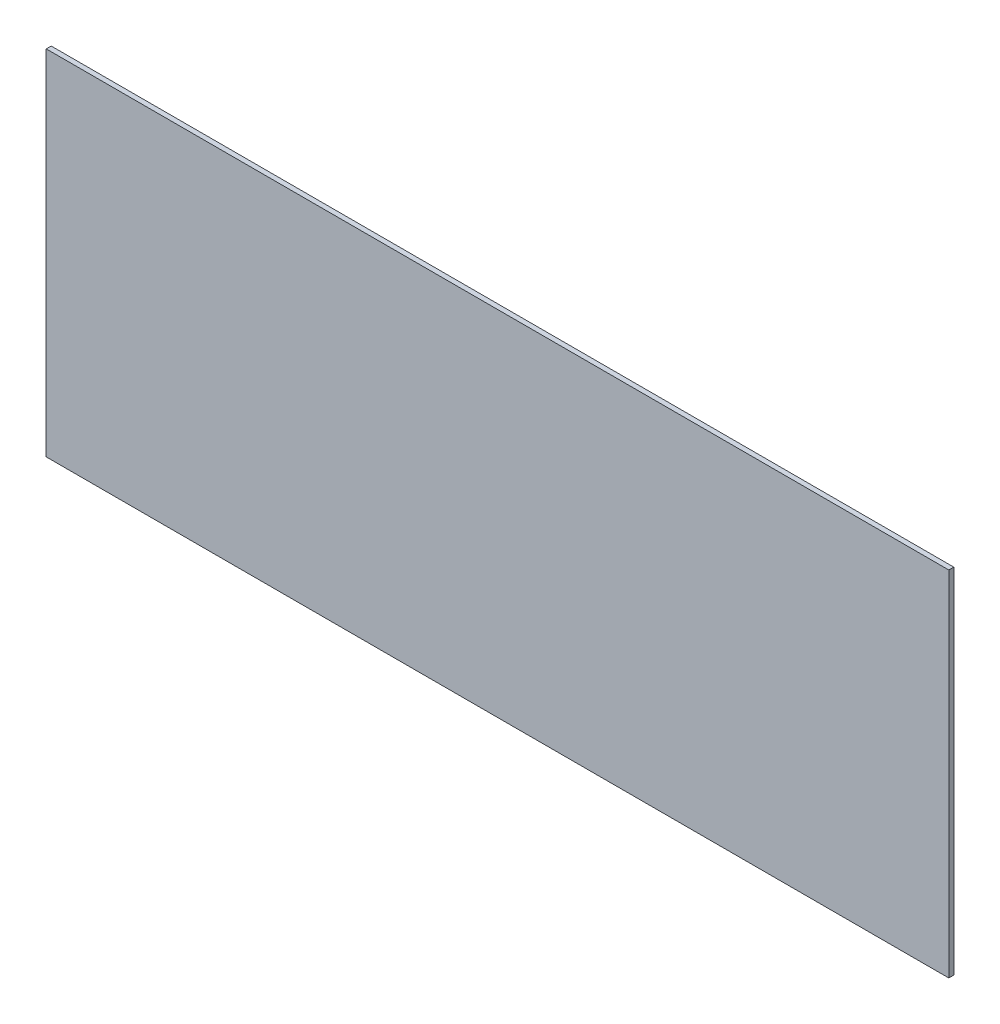
from build123d import *

# Parameters (mm, degrees)
SKETCH1_W           = 23.008
SKETCH1_H           = 9.008
BOSS_EXTRUDE1_DEPTH = 0.127
WRAP1_START         = -0.0762
WRAP1_DEPTH         = 0.0762


# Read off the part's stored shape, not the designer's step: Wrap1
with BuildPart() as part:
    # Sketch1 → Boss-Extrude1 (new body)
    with BuildSketch(Plane.XY):
        with Locations((3082.138757164, 1134.305694712)):
            Rectangle(SKETCH1_W, SKETCH1_H)
    extrude(amount=BOSS_EXTRUDE1_DEPTH)

    # Wrap1 outline → Wrap1 (cut)
    # profile 1 of 6: a face of its own
    with BuildSketch(Plane(origin=(0, 0, 0), x_dir=(-1, 0, 0), z_dir=(0, 0, -1)).offset(WRAP1_START)):
        with BuildLine():
            Line((-3091.032253185, 1132.70167119), (-3091.664348003, 1132.70167119))
            add(Edge.make_bspline(
                [(-3091.664348003, 1132.70167119), (-3091.689861104, 1132.700745243), (-3091.737904003, 1132.699001621), (-3091.804787005, 1132.687352026), (-3091.861891162, 1132.6680349), (-3091.909469605, 1132.640629319), (-3091.945465422, 1132.602956777), (-3091.972332248, 1132.558738878), (-3091.986957789, 1132.505789095), (-3091.98904074, 1132.468363072), (-3091.990142194, 1132.448572387)],
                knots=[0, 0, 0, 0, 0.162897657, 0.306747336, 0.431731416, 0.546374995, 0.653433857, 0.760997037, 0.873616484, 1, 1, 1, 1], degree=3))
            add(Edge.make_bspline(
                [(-3091.990142194, 1132.448572387), (-3091.989087181, 1132.427226643), (-3091.987100987, 1132.387040591), (-3091.972081369, 1132.330609371), (-3091.947181795, 1132.28256978), (-3091.911682944, 1132.243439535), (-3091.866731732, 1132.213103672), (-3091.812074197, 1132.192347186), (-3091.74811324, 1132.17935964), (-3091.702322565, 1132.17782091), (-3091.677927647, 1132.177001154)],
                knots=[0, 0, 0, 0, 0.13549594, 0.255088173, 0.36798027, 0.476021954, 0.587257675, 0.709320559, 0.84514094, 1, 1, 1, 1], degree=3))
            Line((-3091.677927647, 1132.177001154), (-3089.894643621, 1132.177002056))
            add(Edge.make_bspline(
                [(-3089.894643621, 1132.177002056), (-3089.867357056, 1132.177106437), (-3089.816294229, 1132.177301771), (-3089.745007602, 1132.189731835), (-3089.684415238, 1132.208630912), (-3089.633225812, 1132.234862515), (-3089.595441587, 1132.272660527), (-3089.567204421, 1132.317149031), (-3089.552769492, 1132.371054555), (-3089.551362677, 1132.409087208), (-3089.550619656, 1132.429174442)],
                knots=[0, 0, 0, 0, 0.167323449, 0.313121427, 0.442287347, 0.556528349, 0.662166905, 0.766596956, 0.876726412, 1, 1, 1, 1], degree=3))
            add(Edge.make_bspline(
                [(-3089.550619656, 1132.429174442), (-3089.551668879, 1132.450525887), (-3089.553644172, 1132.490722673), (-3089.568736874, 1132.547081924), (-3089.593480126, 1132.595556786), (-3089.630397051, 1132.634211595), (-3089.675586247, 1132.665750864), (-3089.731816795, 1132.686383635), (-3089.79727598, 1132.699293202), (-3089.844288634, 1132.700844218), (-3089.869300184, 1132.701669386)],
                knots=[0, 0, 0, 0, 0.13367795, 0.251665576, 0.363042966, 0.47093762, 0.583363643, 0.705585, 0.843366093, 1, 1, 1, 1], degree=3))
            Line((-3089.869300184, 1132.701669386), (-3090.507584051, 1132.70167119))
            Line((-3090.507584051, 1132.70167119), (-3090.507584051, 1136.070447674))
            add(Edge.make_bspline(
                [(-3090.507584051, 1136.070447674), (-3090.507392066, 1136.090466065), (-3090.507040471, 1136.127127021), (-3090.509196868, 1136.176991703), (-3090.511323971, 1136.217190786), (-3090.517297737, 1136.256675714), (-3090.528509266, 1136.298761128), (-3090.548529631, 1136.324649335), (-3090.558389095, 1136.337398545)],
                knots=[0, 0, 0, 0, 0.216060692, 0.395685733, 0.538969935, 0.649917571, 0.82759431, 1, 1, 1, 1], degree=3))
            add(Edge.make_bspline(
                [(-3090.558389095, 1136.337398545), (-3090.572343179, 1136.350688209), (-3090.600117984, 1136.377140525), (-3090.651684532, 1136.405323969), (-3090.710385719, 1136.422159653), (-3090.751943423, 1136.424732987), (-3090.773613916, 1136.426074866)],
                knots=[0, 0, 0, 0, 0.240761183, 0.479221355, 0.728437127, 1, 1, 1, 1], degree=3))
            add(Edge.make_bspline(
                [(-3090.773613916, 1136.426074866), (-3090.794626492, 1136.426383757), (-3090.834068317, 1136.426963564), (-3090.889504837, 1136.413775263), (-3090.936592789, 1136.389620197), (-3090.973729365, 1136.352344936), (-3091.002973495, 1136.305118), (-3091.021417598, 1136.246484684), (-3091.032825396, 1136.177740875), (-3091.032453259, 1136.128386645), (-3091.032253185, 1136.101852067)],
                knots=[0, 0, 0, 0, 0.1303468, 0.244668505, 0.350952396, 0.455284039, 0.568004952, 0.693428508, 0.835176339, 1, 1, 1, 1], degree=3))
            Line((-3091.032253185, 1136.101852067), (-3091.032253185, 1132.70167119))
        make_face()
    # profile 2 of 6: a face of its own
    with BuildSketch(Plane(origin=(0, 0, 0), x_dir=(-1, 0, 0), z_dir=(0, 0, -1)).offset(WRAP1_START)):
        with BuildLine():
            Line((-3088.189593645, 1135.7166652), (-3088.349213549, 1136.233317708))
            add(Edge.make_bspline(
                [(-3088.349213549, 1136.233317708), (-3088.354084507, 1136.249154792), (-3088.36338243, 1136.279385395), (-3088.385650895, 1136.319441486), (-3088.409892106, 1136.354512012), (-3088.440698145, 1136.381774889), (-3088.475177195, 1136.403447756), (-3088.514375293, 1136.418367583), (-3088.558285406, 1136.425507392), (-3088.58870514, 1136.425878998), (-3088.604738899, 1136.426074866)],
                knots=[0, 0, 0, 0, 0.141702392, 0.270488466, 0.391455134, 0.505507001, 0.62056348, 0.739260185, 0.862568177, 1, 1, 1, 1], degree=3))
            add(Edge.make_bspline(
                [(-3088.604738899, 1136.426074866), (-3088.623619207, 1136.425247441), (-3088.659708091, 1136.423665855), (-3088.711192269, 1136.409863077), (-3088.75776185, 1136.389183685), (-3088.797315359, 1136.35911058), (-3088.830797413, 1136.323697326), (-3088.854764252, 1136.281574597), (-3088.870424779, 1136.23376878), (-3088.872471003, 1136.199894913), (-3088.873538997, 1136.182214983)],
                knots=[0, 0, 0, 0, 0.139395097, 0.266447653, 0.391794452, 0.513870771, 0.631533225, 0.749898934, 0.8694637, 1, 1, 1, 1], degree=3))
            add(Edge.make_bspline(
                [(-3088.873538997, 1136.182214983), (-3088.87310161, 1136.170812912), (-3088.872235199, 1136.148226771), (-3088.867474502, 1136.112164656), (-3088.855256874, 1136.069450506), (-3088.846410223, 1136.037501511), (-3088.841209088, 1136.018718016)],
                knots=[0, 0, 0, 0, 0.204595306, 0.40527887, 0.650350765, 1, 1, 1, 1], degree=3))
            Line((-3088.841209088, 1136.018718016), (-3087.742657915, 1132.417925726))
            add(Edge.make_bspline(
                [(-3087.742657915, 1132.417925726), (-3087.736296283, 1132.396484229), (-3087.724398496, 1132.356383458), (-3087.698475546, 1132.304029111), (-3087.673757527, 1132.259868469), (-3087.642890662, 1132.227287653), (-3087.608040108, 1132.202964263), (-3087.567192916, 1132.186112961), (-3087.519771901, 1132.177153086), (-3087.486160141, 1132.177053343), (-3087.468573537, 1132.177001154)],
                knots=[0, 0, 0, 0, 0.166404298, 0.311216181, 0.434859544, 0.542060845, 0.642692704, 0.749721755, 0.869047485, 1, 1, 1, 1], degree=3))
            add(Edge.make_bspline(
                [(-3087.468573537, 1132.177001154), (-3087.452519127, 1132.176747551), (-3087.422052227, 1132.176266281), (-3087.378598764, 1132.184356886), (-3087.338910114, 1132.196529938), (-3087.304544285, 1132.217609662), (-3087.274404286, 1132.243751055), (-3087.248884638, 1132.276360255), (-3087.227554815, 1132.314922168), (-3087.218365144, 1132.343991205), (-3087.213629115, 1132.358972354)],
                knots=[0, 0, 0, 0, 0.140277472, 0.266208441, 0.38561614, 0.501718756, 0.616402935, 0.733503765, 0.862657308, 1, 1, 1, 1], degree=3))
            Line((-3087.213629115, 1132.358972354), (-3086.127304492, 1135.974980629))
            add(Edge.make_bspline(
                [(-3086.127304492, 1135.974980629), (-3086.122369271, 1135.991399736), (-3086.1131975, 1136.021913522), (-3086.101046473, 1136.063473676), (-3086.093117816, 1136.09730565), (-3086.084389473, 1136.129294007), (-3086.077655767, 1136.160975457), (-3086.076882779, 1136.184649868), (-3086.076540041, 1136.195146947)],
                knots=[0, 0, 0, 0, 0.22700634, 0.421875753, 0.573150886, 0.686858716, 0.861155217, 1, 1, 1, 1], degree=3))
            add(Edge.make_bspline(
                [(-3086.076540041, 1136.195146947), (-3086.077565322, 1136.211320478), (-3086.079569561, 1136.2429368), (-3086.096516142, 1136.287052903), (-3086.120727288, 1136.32737218), (-3086.155240442, 1136.360609937), (-3086.195447417, 1136.388669599), (-3086.240477688, 1136.410313553), (-3086.291208637, 1136.422098627), (-3086.326195749, 1136.424713227), (-3086.344416427, 1136.426074866)],
                knots=[0, 0, 0, 0, 0.123314737, 0.241057959, 0.357426238, 0.480695961, 0.604213056, 0.731731648, 0.860290518, 1, 1, 1, 1], degree=3))
            add(Edge.make_bspline(
                [(-3086.344416427, 1136.426074866), (-3086.373999664, 1136.424829101), (-3086.429120714, 1136.422507927), (-3086.504191022, 1136.391388161), (-3086.562882952, 1136.337799184), (-3086.583224767, 1136.28955198), (-3086.59381858, 1136.264425322)],
                knots=[0, 0, 0, 0, 0.275840125, 0.513959899, 0.746875208, 1, 1, 1, 1], degree=3))
            Line((-3086.59381858, 1136.264425322), (-3086.75939931, 1135.7166652))
            Line((-3086.75939931, 1135.7166652), (-3088.189593645, 1135.7166652))
        make_face()
        Polygon((-3088.023588945, 1135.191996066), (-3086.92540401, 1135.191996066), (-3087.474496478, 1133.353443593), align=None, mode=Mode.SUBTRACT)
    # profile 3 of 6: a face of its own
    with BuildSketch(Plane(origin=(0, 0, 0), x_dir=(-1, 0, 0), z_dir=(0, 0, -1)).offset(WRAP1_START)):
        with BuildLine():
            Line((-3083.523767204, 1132.70167119), (-3085.06888787, 1132.70167119))
            add(Edge.make_bspline(
                [(-3085.06888787, 1132.70167119), (-3085.095973862, 1132.701799579), (-3085.146465823, 1132.702038914), (-3085.216799298, 1132.691492276), (-3085.275633763, 1132.670918659), (-3085.324529272, 1132.642404485), (-3085.361718573, 1132.603209752), (-3085.38740724, 1132.555113162), (-3085.401260635, 1132.497987097), (-3085.401290789, 1132.457268205), (-3085.401306805, 1132.435640423)],
                knots=[0, 0, 0, 0, 0.164401574, 0.30646683, 0.429516722, 0.541147658, 0.646987278, 0.753272194, 0.868950875, 1, 1, 1, 1], degree=3))
            add(Edge.make_bspline(
                [(-3085.401306805, 1132.435640423), (-3085.401245958, 1132.414619081), (-3085.401131773, 1132.375170753), (-3085.387926638, 1132.320001356), (-3085.364977804, 1132.272717247), (-3085.328677806, 1132.235830666), (-3085.28349275, 1132.206464), (-3085.22704349, 1132.187646902), (-3085.160975649, 1132.176545484), (-3085.11346748, 1132.176842818), (-3085.088168547, 1132.177001154)],
                knots=[0, 0, 0, 0, 0.133385332, 0.250308863, 0.358107032, 0.463454922, 0.575429264, 0.698153607, 0.839261499, 1, 1, 1, 1], degree=3))
            Line((-3085.088168547, 1132.177001154), (-3083.33222332, 1132.177002056))
            add(Edge.make_bspline(
                [(-3083.33222332, 1132.177002056), (-3083.302596628, 1132.177028806), (-3083.247926702, 1132.177078167), (-3083.172996724, 1132.189837525), (-3083.111843229, 1132.211110005), (-3083.063546087, 1132.244804285), (-3083.0312525, 1132.294176878), (-3083.009245166, 1132.355690307), (-3082.999148242, 1132.432251413), (-3083.000075164, 1132.4876624), (-3083.000580158, 1132.517850763)],
                knots=[0, 0, 0, 0, 0.156514694, 0.288815458, 0.400161158, 0.496932744, 0.594087477, 0.706959909, 0.840349341, 1, 1, 1, 1], degree=3))
            Line((-3083.000580158, 1132.517850763), (-3083.000213921, 1136.078384017))
            add(Edge.make_bspline(
                [(-3083.000213921, 1136.078384017), (-3082.999408286, 1136.108978566), (-3082.997926048, 1136.165267531), (-3083.004593344, 1136.243443319), (-3083.024438832, 1136.306335929), (-3083.055364444, 1136.356560068), (-3083.102638143, 1136.39121991), (-3083.16415529, 1136.413719499), (-3083.240576665, 1136.425845863), (-3083.296432587, 1136.42599447), (-3083.32665038, 1136.426074866)],
                knots=[0, 0, 0, 0, 0.16005613, 0.294477095, 0.40801996, 0.502248162, 0.597570488, 0.70819914, 0.842137095, 1, 1, 1, 1], degree=3))
            Line((-3083.32665038, 1136.426074866), (-3085.06888787, 1136.426074866))
            add(Edge.make_bspline(
                [(-3085.06888787, 1136.426074866), (-3085.097519646, 1136.42585017), (-3085.150772812, 1136.425432251), (-3085.224846618, 1136.414685237), (-3085.287147642, 1136.395497266), (-3085.338934719, 1136.368105205), (-3085.378130218, 1136.329648143), (-3085.405799619, 1136.282969842), (-3085.420912109, 1136.227155191), (-3085.420776652, 1136.187539816), (-3085.420704751, 1136.166511885)],
                knots=[0, 0, 0, 0, 0.17008837, 0.316352865, 0.443130698, 0.55620467, 0.661053016, 0.765276352, 0.875408155, 1, 1, 1, 1], degree=3))
            add(Edge.make_bspline(
                [(-3085.420704751, 1136.166511885), (-3085.420684468, 1136.144887354), (-3085.420646282, 1136.104174584), (-3085.406846303, 1136.04700781), (-3085.381076981, 1135.999237009), (-3085.344954125, 1135.959833313), (-3085.296864075, 1135.93078854), (-3085.238379089, 1135.912211377), (-3085.169894144, 1135.900887054), (-3085.120856396, 1135.901225602), (-3085.094634529, 1135.901406633)],
                knots=[0, 0, 0, 0, 0.132714985, 0.249864141, 0.35750012, 0.463388537, 0.574824211, 0.698817694, 0.838949322, 1, 1, 1, 1], degree=3))
            Line((-3085.094634529, 1135.901406633), (-3083.523767204, 1135.901406633))
            Line((-3083.523767204, 1135.901406633), (-3083.523767204, 1134.297844065))
            Line((-3083.523767204, 1134.297844065), (-3084.62195214, 1134.297844065))
            add(Edge.make_bspline(
                [(-3084.62195214, 1134.297844065), (-3084.64899768, 1134.297604901), (-3084.699447206, 1134.297158776), (-3084.769541204, 1134.286527166), (-3084.828470572, 1134.267128748), (-3084.877354004, 1134.23953675), (-3084.914615377, 1134.201300076), (-3084.940136659, 1134.154356961), (-3084.954234953, 1134.098822059), (-3084.954231951, 1134.059300589), (-3084.954230354, 1134.038280182)],
                knots=[0, 0, 0, 0, 0.166190244, 0.310003759, 0.433947569, 0.545980445, 0.651758679, 0.75768932, 0.871121468, 1, 1, 1, 1], degree=3))
            add(Edge.make_bspline(
                [(-3084.954230354, 1134.038280182), (-3084.9538903, 1134.016929199), (-3084.953250728, 1133.976772366), (-3084.938805954, 1133.920949396), (-3084.916110001, 1133.872701495), (-3084.880086636, 1133.834715347), (-3084.834357175, 1133.805593704), (-3084.778823349, 1133.785822731), (-3084.713684692, 1133.773490075), (-3084.667020258, 1133.773284881), (-3084.642015807, 1133.773174931)],
                knots=[0, 0, 0, 0, 0.135054949, 0.25401074, 0.363244754, 0.469717383, 0.581371432, 0.704413742, 0.841614447, 1, 1, 1, 1], degree=3))
            Line((-3084.642015807, 1133.773174931), (-3083.523767204, 1133.773174931))
            Line((-3083.523767204, 1133.773174931), (-3083.523767204, 1132.70167119))
        make_face()
    # profile 4 of 6: a face of its own
    with BuildSketch(Plane(origin=(0, 0, 0), x_dir=(-1, 0, 0), z_dir=(0, 0, -1)).offset(WRAP1_START)):
        with BuildLine():
            add(Edge.make_bspline(
                [(-3080.927675538, 1132.193629768), (-3080.893744735, 1132.196301277), (-3080.826917234, 1132.201562874), (-3080.72962119, 1132.221660953), (-3080.637032063, 1132.24906756), (-3080.549255647, 1132.285309417), (-3080.466961385, 1132.330710286), (-3080.389748008, 1132.384821449), (-3080.317434471, 1132.447093192), (-3080.250107514, 1132.517121479), (-3080.189282268, 1132.594374367), (-3080.136544331, 1132.6781931), (-3080.091120732, 1132.766812259), (-3080.054005169, 1132.861239284), (-3080.024433732, 1132.960724332), (-3080.003677194, 1133.065597555), (-3079.989065466, 1133.175445239), (-3079.986764781, 1133.250612582), (-3079.985585246, 1133.289150012)],
                knots=[0, 0, 0, 0, 0.063599333, 0.125260361, 0.185380231, 0.243983491, 0.302487647, 0.360795932, 0.420007138, 0.480689722, 0.54220538, 0.603551003, 0.665616721, 0.728172033, 0.793035682, 0.859440249, 0.927936636, 1, 1, 1, 1], degree=3))
            add(Edge.make_bspline(
                [(-3079.985585246, 1133.289150012), (-3079.987473235, 1133.336018443), (-3079.991218342, 1133.428988956), (-3080.012297227, 1133.566109235), (-3080.04924075, 1133.698256755), (-3080.097458478, 1133.824635157), (-3080.15721961, 1133.942793156), (-3080.226887559, 1134.049607877), (-3080.308154159, 1134.142585612), (-3080.369775718, 1134.194505864), (-3080.400331789, 1134.220251382)],
                knots=[0, 0, 0, 0, 0.133571488, 0.264958941, 0.394137348, 0.523815182, 0.649747928, 0.770668013, 0.886281932, 1, 1, 1, 1], degree=3))
            add(Edge.make_bspline(
                [(-3080.400331789, 1134.220251382), (-3080.427054299, 1134.238415885), (-3080.48090463, 1134.275020399), (-3080.572358909, 1134.320633418), (-3080.680565562, 1134.360412608), (-3080.760058324, 1134.381985751), (-3080.803993792, 1134.393909177)],
                knots=[0, 0, 0, 0, 0.219024644, 0.441371329, 0.691247208, 1, 1, 1, 1], degree=3))
            Line((-3080.803993792, 1134.393909177), (-3081.366214873, 1134.535896471))
            add(Edge.make_bspline(
                [(-3081.366214873, 1134.535896471), (-3081.393385505, 1134.542556401), (-3081.44471879, 1134.555138958), (-3081.513387011, 1134.585433688), (-3081.5715426, 1134.619395129), (-3081.601063303, 1134.649437258), (-3081.615012644, 1134.663632987)],
                knots=[0, 0, 0, 0, 0.294796546, 0.556957043, 0.79065006, 1, 1, 1, 1], degree=3))
            add(Edge.make_bspline(
                [(-3081.615012644, 1134.663632987), (-3081.630602302, 1134.680789012), (-3081.662355994, 1134.715733147), (-3081.701045057, 1134.776197867), (-3081.735985046, 1134.841859014), (-3081.765092833, 1134.91303399), (-3081.787762544, 1134.988968086), (-3081.805646909, 1135.066929081), (-3081.815928927, 1135.147386001), (-3081.817455534, 1135.201513137), (-3081.818229212, 1135.228944533)],
                knots=[0, 0, 0, 0, 0.112997851, 0.230158927, 0.349185819, 0.475927561, 0.60480001, 0.735733993, 0.866071147, 1, 1, 1, 1], degree=3))
            add(Edge.make_bspline(
                [(-3081.818229212, 1135.228944533), (-3081.817665127, 1135.25732654), (-3081.816556141, 1135.313125284), (-3081.803391096, 1135.395191149), (-3081.785505483, 1135.474822834), (-3081.759559945, 1135.551165135), (-3081.727547113, 1135.623021655), (-3081.689495434, 1135.6889523), (-3081.646241141, 1135.74887806), (-3081.612377408, 1135.783556211), (-3081.595614698, 1135.800722061)],
                knots=[0, 0, 0, 0, 0.135094081, 0.26559362, 0.395124796, 0.523630082, 0.64905025, 0.769328651, 0.885816585, 1, 1, 1, 1], degree=3))
            add(Edge.make_bspline(
                [(-3081.595614698, 1135.800722061), (-3081.574183791, 1135.818786527), (-3081.530416913, 1135.855678352), (-3081.447741699, 1135.891173993), (-3081.352854094, 1135.912399482), (-3081.285070672, 1135.914876191), (-3081.24922282, 1135.91618602)],
                knots=[0, 0, 0, 0, 0.223770634, 0.456991469, 0.712825212, 1, 1, 1, 1], degree=3))
            Line((-3081.24922282, 1135.91618602), (-3080.934220901, 1135.916967206))
            add(Edge.make_bspline(
                [(-3080.934220901, 1135.916967206), (-3080.916070634, 1135.917602823), (-3080.880647264, 1135.91884334), (-3080.828325802, 1135.915956203), (-3080.778907902, 1135.903998663), (-3080.731035074, 1135.887722033), (-3080.685856383, 1135.863666474), (-3080.644095182, 1135.832272793), (-3080.60363272, 1135.795982701), (-3080.553347325, 1135.737893556), (-3080.500914912, 1135.652183805), (-3080.454573494, 1135.535257162), (-3080.4293031, 1135.402762311), (-3080.427259641, 1135.309717916), (-3080.426195716, 1135.261274442)],
                knots=[0, 0, 0, 0, 0.057893916, 0.112989943, 0.166318385, 0.219393398, 0.27382999, 0.328592895, 0.385562358, 0.446769483, 0.572846214, 0.703690997, 0.845727005, 1, 1, 1, 1], degree=3))
            add(Edge.make_bspline(
                [(-3080.426195716, 1135.261274442), (-3080.425942735, 1135.23568287), (-3080.425467418, 1135.187599848), (-3080.414755657, 1135.120170311), (-3080.3952197, 1135.063232832), (-3080.369622083, 1135.015135915), (-3080.334274836, 1134.977784834), (-3080.290630334, 1134.951256649), (-3080.238965048, 1134.936597702), (-3080.202440749, 1134.934472745), (-3080.183259545, 1134.933356796)],
                knots=[0, 0, 0, 0, 0.164761429, 0.30956393, 0.437544781, 0.551227783, 0.657873367, 0.764703299, 0.876430919, 1, 1, 1, 1], degree=3))
            add(Edge.make_bspline(
                [(-3080.183259545, 1134.933356796), (-3080.161552898, 1134.935248214), (-3080.120394241, 1134.938834591), (-3080.062865665, 1134.957875112), (-3080.013538007, 1134.987900989), (-3079.973075092, 1135.029597518), (-3079.942065905, 1135.082267294), (-3079.920611277, 1135.145469033), (-3079.905379777, 1135.219009181), (-3079.90346671, 1135.271961566), (-3079.902451195, 1135.300070332)],
                knots=[0, 0, 0, 0, 0.125243407, 0.237477963, 0.34582937, 0.455005964, 0.568828628, 0.695123677, 0.838162205, 1, 1, 1, 1], degree=3))
            add(Edge.make_bspline(
                [(-3079.902451195, 1135.300070332), (-3079.903991609, 1135.341675658), (-3079.906990648, 1135.422677277), (-3079.921680492, 1135.541129257), (-3079.946385432, 1135.652939123), (-3079.976435183, 1135.759772361), (-3080.019141437, 1135.858678278), (-3080.067954127, 1135.952266389), (-3080.126427477, 1136.039094133), (-3080.192959346, 1136.119532938), (-3080.266246297, 1136.192025825), (-3080.345608458, 1136.255813749), (-3080.430575669, 1136.309334066), (-3080.521122699, 1136.353081556), (-3080.616815196, 1136.387415156), (-3080.717752469, 1136.412005249), (-3080.824088861, 1136.428532619), (-3080.896916422, 1136.430572032), (-3080.934237138, 1136.431617136)],
                knots=[0, 0, 0, 0, 0.072749061, 0.14163551, 0.208239069, 0.272775527, 0.335243706, 0.396150844, 0.457048471, 0.517822323, 0.57832872, 0.636908998, 0.695437342, 0.753443789, 0.812342086, 0.872774246, 0.934802758, 1, 1, 1, 1], degree=3))
            Line((-3080.934237138, 1136.431617136), (-3081.268034425, 1136.426074866))
            add(Edge.make_bspline(
                [(-3081.268034425, 1136.426074866), (-3081.307085246, 1136.42398631), (-3081.383507612, 1136.419899011), (-3081.495182287, 1136.402308886), (-3081.600791909, 1136.374219912), (-3081.701476019, 1136.338004003), (-3081.79473753, 1136.288820272), (-3081.883522514, 1136.232548159), (-3081.966074038, 1136.165721411), (-3082.041556391, 1136.088611968), (-3082.110388081, 1136.004337818), (-3082.171377382, 1135.913083428), (-3082.221572829, 1135.814713455), (-3082.26484837, 1135.710583354), (-3082.2978557, 1135.599384833), (-3082.321415065, 1135.481546514), (-3082.337739442, 1135.357468548), (-3082.340541678, 1135.272411893), (-3082.341973733, 1135.228944533)],
                knots=[0, 0, 0, 0, 0.065201432, 0.127599052, 0.188140811, 0.247289808, 0.305632859, 0.363615379, 0.422408788, 0.482330892, 0.54329163, 0.60368726, 0.665018977, 0.727202757, 0.791546249, 0.858124041, 0.927495697, 1, 1, 1, 1], degree=3))
            add(Edge.make_bspline(
                [(-3082.341973733, 1135.228944533), (-3082.341018141, 1135.191033892), (-3082.339141016, 1135.11656384), (-3082.326370462, 1135.007108243), (-3082.308730894, 1134.9019414), (-3082.282137762, 1134.80152352), (-3082.250401593, 1134.70513138), (-3082.209967305, 1134.613466837), (-3082.164408192, 1134.525460131), (-3082.110483109, 1134.443150807), (-3082.050456514, 1134.366886442), (-3081.985697215, 1134.295666119), (-3081.914206563, 1134.232462869), (-3081.838356736, 1134.174136356), (-3081.755692896, 1134.124850632), (-3081.668429717, 1134.081061361), (-3081.575768214, 1134.043781601), (-3081.511118205, 1134.024814609), (-3081.478303315, 1134.01518739)],
                knots=[0, 0, 0, 0, 0.070616639, 0.138716328, 0.205110655, 0.269112602, 0.332059551, 0.393976046, 0.455559475, 0.516498315, 0.576973694, 0.636245435, 0.695556026, 0.754527205, 0.814244199, 0.874531558, 0.936315042, 1, 1, 1, 1], degree=3))
            Line((-3081.478303315, 1134.01518739), (-3080.914584811, 1133.874267236))
            add(Edge.make_bspline(
                [(-3080.914584811, 1133.874267236), (-3080.883552096, 1133.865776739), (-3080.825350472, 1133.849852877), (-3080.748236073, 1133.814307257), (-3080.683869499, 1133.773951655), (-3080.654462654, 1133.737100783), (-3080.640496825, 1133.719599654)],
                knots=[0, 0, 0, 0, 0.299891668, 0.56244457, 0.792197206, 1, 1, 1, 1], degree=3))
            add(Edge.make_bspline(
                [(-3080.640496825, 1133.719599654), (-3080.620715235, 1133.689055799), (-3080.581008357, 1133.627746212), (-3080.539060036, 1133.524476059), (-3080.515295295, 1133.412461208), (-3080.511347644, 1133.335139616), (-3080.509329767, 1133.295615994)],
                knots=[0, 0, 0, 0, 0.241778697, 0.485313731, 0.736913526, 1, 1, 1, 1], degree=3))
            add(Edge.make_bspline(
                [(-3080.509329767, 1133.295615994), (-3080.510547497, 1133.269115426), (-3080.512918919, 1133.217507924), (-3080.52175183, 1133.142290097), (-3080.537390491, 1133.072063012), (-3080.559061508, 1133.007072682), (-3080.584403255, 1132.946087395), (-3080.617463282, 1132.891032036), (-3080.653773163, 1132.838977657), (-3080.68372627, 1132.809627451), (-3080.698690661, 1132.794964266)],
                knots=[0, 0, 0, 0, 0.144669834, 0.281731651, 0.412517926, 0.536256951, 0.655113272, 0.771766142, 0.885975748, 1, 1, 1, 1], degree=3))
            add(Edge.make_bspline(
                [(-3080.698690661, 1132.794964266), (-3080.714961719, 1132.783540137), (-3080.75072193, 1132.758432414), (-3080.814804761, 1132.733803269), (-3080.883548494, 1132.712743429), (-3080.93132584, 1132.707157044), (-3080.954558795, 1132.704440521)],
                knots=[0, 0, 0, 0, 0.216441272, 0.47569036, 0.745041044, 1, 1, 1, 1], degree=3))
            Line((-3080.954558795, 1132.704440521), (-3081.215671519, 1132.698751215))
            Line((-3081.215671519, 1132.698751215), (-3081.241852972, 1132.698751215))
            add(Edge.make_bspline(
                [(-3081.241852972, 1132.698751215), (-3081.273135104, 1132.699915175), (-3081.332665453, 1132.702130209), (-3081.416253304, 1132.726660987), (-3081.490092242, 1132.763573279), (-3081.553755241, 1132.817152009), (-3081.607083592, 1132.887347255), (-3081.653101464, 1132.973436304), (-3081.69154552, 1133.077092824), (-3081.710331424, 1133.152830735), (-3081.720315775, 1133.193083998)],
                knots=[0, 0, 0, 0, 0.123786576, 0.23556764, 0.342676436, 0.449373233, 0.562541452, 0.690484287, 0.835498271, 1, 1, 1, 1], degree=3))
            add(Edge.make_bspline(
                [(-3081.720315775, 1133.193083998), (-3081.723666192, 1133.206333778), (-3081.729671525, 1133.230082859), (-3081.738103507, 1133.261455291), (-3081.744137899, 1133.284678118), (-3081.750773099, 1133.303370775), (-3081.75335228, 1133.319661527), (-3081.757443294, 1133.330139021), (-3081.759111665, 1133.334411885)],
                knots=[0, 0, 0, 0, 0.279617859, 0.501190759, 0.664744974, 0.770350089, 0.906345655, 1, 1, 1, 1], degree=3))
            add(Edge.make_bspline(
                [(-3081.759111665, 1133.334411885), (-3081.771049381, 1133.352242626), (-3081.79447772, 1133.387236308), (-3081.84784962, 1133.424900252), (-3081.912756566, 1133.446027311), (-3081.959697998, 1133.448545485), (-3081.984497314, 1133.449875844)],
                knots=[0, 0, 0, 0, 0.240289466, 0.471579558, 0.720833701, 1, 1, 1, 1], degree=3))
            add(Edge.make_bspline(
                [(-3081.984497314, 1133.449875844), (-3082.003977664, 1133.4480068), (-3082.04102858, 1133.444451945), (-3082.092857271, 1133.43011286), (-3082.136476915, 1133.406070852), (-3082.173480667, 1133.375619718), (-3082.201704526, 1133.335866013), (-3082.223309681, 1133.289057766), (-3082.235767307, 1133.233713979), (-3082.238175322, 1133.194375054), (-3082.239441737, 1133.173686053)],
                knots=[0, 0, 0, 0, 0.138666773, 0.263739154, 0.37805668, 0.489608986, 0.600539826, 0.720713111, 0.853118334, 1, 1, 1, 1], degree=3))
            add(Edge.make_bspline(
                [(-3082.239441737, 1133.173686053), (-3082.237334233, 1133.138451762), (-3082.232791753, 1133.062508347), (-3082.20432251, 1132.945868081), (-3082.163209866, 1132.823699944), (-3082.124846879, 1132.744416644), (-3082.105503544, 1132.704440521)],
                knots=[0, 0, 0, 0, 0.214938982, 0.463275972, 0.729373707, 1, 1, 1, 1], degree=3))
            add(Edge.make_bspline(
                [(-3082.105503544, 1132.704440521), (-3082.082265699, 1132.663994839), (-3082.036523646, 1132.584380376), (-3081.950144518, 1132.479056935), (-3081.854531746, 1132.386265812), (-3081.748861414, 1132.309307783), (-3081.637488064, 1132.248552994), (-3081.524193093, 1132.204030991), (-3081.409238226, 1132.178800383), (-3081.332471442, 1132.177596751), (-3081.294484692, 1132.177001154)],
                knots=[0, 0, 0, 0, 0.137457703, 0.270575754, 0.400396349, 0.529806033, 0.655052246, 0.773856294, 0.888096596, 1, 1, 1, 1], degree=3))
            Line((-3081.294484692, 1132.177001154), (-3081.261489061, 1132.177002056))
            Line((-3081.261489061, 1132.177002056), (-3080.927675538, 1132.193629768))
        make_face()
    # profile 5 of 6: a face of its own
    with BuildSketch(Plane(origin=(0, 0, 0), x_dir=(-1, 0, 0), z_dir=(0, 0, -1)).offset(WRAP1_START)):
        with BuildLine():
            Line((-3075.661133414, 1133.613156316), (-3075.661133414, 1132.500159519))
            add(Edge.make_bspline(
                [(-3075.661133414, 1132.500159519), (-3075.661244588, 1132.47397151), (-3075.661452877, 1132.424906881), (-3075.649159154, 1132.356770908), (-3075.629640124, 1132.298724613), (-3075.599167219, 1132.252040854), (-3075.56049221, 1132.215483881), (-3075.512082293, 1132.19112022), (-3075.455582042, 1132.17703753), (-3075.415146894, 1132.177013717), (-3075.393814503, 1132.177001154)],
                knots=[0, 0, 0, 0, 0.161504012, 0.302586358, 0.425968783, 0.537321442, 0.643685602, 0.750914181, 0.868589674, 1, 1, 1, 1], degree=3))
            add(Edge.make_bspline(
                [(-3075.393814503, 1132.177001154), (-3075.374616756, 1132.178147508), (-3075.337848835, 1132.180343029), (-3075.285992147, 1132.194785775), (-3075.239489722, 1132.216477482), (-3075.214195214, 1132.238270199), (-3075.201682474, 1132.249050665)],
                knots=[0, 0, 0, 0, 0.274073161, 0.524910581, 0.764981781, 1, 1, 1, 1], degree=3))
            add(Edge.make_bspline(
                [(-3075.201682474, 1132.249050665), (-3075.189286201, 1132.260925725), (-3075.164509923, 1132.28466026), (-3075.147795453, 1132.327555049), (-3075.142957084, 1132.369030849), (-3075.139060494, 1132.411544469), (-3075.137574565, 1132.464882272), (-3075.137815501, 1132.503995648), (-3075.137946368, 1132.525240456)],
                knots=[0, 0, 0, 0, 0.173693847, 0.34715975, 0.455243266, 0.600463828, 0.782988072, 1, 1, 1, 1], degree=3))
            Line((-3075.137946368, 1132.525240456), (-3075.137580131, 1136.128657747))
            add(Edge.make_bspline(
                [(-3075.137580131, 1136.128657747), (-3075.138698048, 1136.152093608), (-3075.140803208, 1136.196225907), (-3075.152021801, 1136.258361395), (-3075.173297282, 1136.310824782), (-3075.202498019, 1136.353824428), (-3075.239826824, 1136.387863976), (-3075.286292015, 1136.4105412), (-3075.340294064, 1136.425046715), (-3075.378929777, 1136.425719277), (-3075.399356773, 1136.426074866)],
                knots=[0, 0, 0, 0, 0.155105653, 0.292080968, 0.415354546, 0.526624502, 0.633329136, 0.74534189, 0.865360314, 1, 1, 1, 1], degree=3))
            add(Edge.make_bspline(
                [(-3075.399356773, 1136.426074866), (-3075.419716768, 1136.425475098), (-3075.458078883, 1136.424345021), (-3075.512790766, 1136.413015117), (-3075.558559413, 1136.389180684), (-3075.597417158, 1136.357017011), (-3075.626008571, 1136.314100062), (-3075.64656413, 1136.262214883), (-3075.65919729, 1136.201280088), (-3075.660830311, 1136.157338518), (-3075.661690889, 1136.134181976)],
                knots=[0, 0, 0, 0, 0.135582886, 0.255464015, 0.368261459, 0.475909071, 0.587958513, 0.707523564, 0.845869346, 1, 1, 1, 1], degree=3))
            Line((-3075.661690889, 1136.134181976), (-3075.661133414, 1134.468812813))
            Line((-3075.661133414, 1134.468812813), (-3076.044221183, 1133.986299751))
            Line((-3076.044221183, 1133.986299751), (-3076.957247031, 1136.25089439))
            add(Edge.make_bspline(
                [(-3076.957247031, 1136.25089439), (-3076.970793676, 1136.277823395), (-3076.996322441, 1136.32857133), (-3077.054223624, 1136.388498983), (-3077.12758234, 1136.422253157), (-3077.179934268, 1136.424770499), (-3077.207060524, 1136.426074866)],
                knots=[0, 0, 0, 0, 0.276442295, 0.520957803, 0.75178333, 1, 1, 1, 1], degree=3))
            add(Edge.make_bspline(
                [(-3077.207060524, 1136.426074866), (-3077.225911036, 1136.425137747), (-3077.261868274, 1136.423350199), (-3077.313278696, 1136.411139451), (-3077.358931255, 1136.390622992), (-3077.39898339, 1136.362982465), (-3077.431816944, 1136.328422358), (-3077.456183537, 1136.288170011), (-3077.471821309, 1136.242111867), (-3077.473867913, 1136.209440793), (-3077.47493691, 1136.192375812)],
                knots=[0, 0, 0, 0, 0.142338238, 0.271509316, 0.39642317, 0.51835724, 0.636803863, 0.753664538, 0.871332351, 1, 1, 1, 1], degree=3))
            add(Edge.make_bspline(
                [(-3077.47493691, 1136.192375812), (-3077.474426511, 1136.177858695), (-3077.473363507, 1136.147623979), (-3077.462726374, 1136.098675779), (-3077.443951191, 1136.040198972), (-3077.427203731, 1135.997672887), (-3077.417666786, 1135.973456144)],
                knots=[0, 0, 0, 0, 0.191072267, 0.397945146, 0.65715612, 1, 1, 1, 1], degree=3))
            Line((-3077.417666786, 1135.973456144), (-3076.414539359, 1133.503786688))
            Line((-3076.414539359, 1133.503786688), (-3077.053018973, 1132.699598251))
            Line((-3077.053018973, 1132.699598251), (-3077.084942953, 1132.654563699))
            add(Edge.make_bspline(
                [(-3077.084942953, 1132.654563699), (-3077.097192536, 1132.641166932), (-3077.119342955, 1132.616942108), (-3077.146974707, 1132.58210151), (-3077.168787311, 1132.554698926), (-3077.187950263, 1132.525338261), (-3077.200905613, 1132.485633141), (-3077.200704421, 1132.453299279), (-3077.200594542, 1132.435640423)],
                knots=[0, 0, 0, 0, 0.212616316, 0.384465368, 0.520843898, 0.622948696, 0.794076727, 1, 1, 1, 1], degree=3))
            add(Edge.make_bspline(
                [(-3077.200594542, 1132.435640423), (-3077.19913725, 1132.416133818), (-3077.196340991, 1132.378704463), (-3077.181314693, 1132.326889136), (-3077.159938268, 1132.282379131), (-3077.131737505, 1132.244676768), (-3077.094720242, 1132.216116433), (-3077.051287881, 1132.194137573), (-3077.000145308, 1132.181755663), (-3076.963875447, 1132.178643992), (-3076.944726407, 1132.177001154)],
                knots=[0, 0, 0, 0, 0.143221006, 0.274813062, 0.393040554, 0.504213508, 0.616778318, 0.732980582, 0.859024399, 1, 1, 1, 1], degree=3))
            add(Edge.make_bspline(
                [(-3076.944726407, 1132.177001154), (-3076.921831275, 1132.177569874), (-3076.880065623, 1132.178607342), (-3076.821505534, 1132.194058077), (-3076.769966253, 1132.222504376), (-3076.742364529, 1132.250667768), (-3076.727654164, 1132.265677475)],
                knots=[0, 0, 0, 0, 0.282245622, 0.51487681, 0.741453126, 1, 1, 1, 1], degree=3))
            Line((-3076.727654164, 1132.265677475), (-3075.661133414, 1133.613156316))
        make_face()
    # profile 6 of 6: a face of its own
    with BuildSketch(Plane(origin=(0, 0, 0), x_dir=(-1, 0, 0), z_dir=(0, 0, -1)).offset(WRAP1_START)):
        with BuildLine():
            add(Edge.make_bspline(
                [(-3073.474507618, 1132.177002056), (-3073.436803103, 1132.178590759), (-3073.36188755, 1132.181747372), (-3073.250961959, 1132.202024215), (-3073.142576675, 1132.23342059), (-3073.036405864, 1132.276984306), (-3072.933978401, 1132.334159935), (-3072.833347697, 1132.401819573), (-3072.736120895, 1132.482546293), (-3072.675739992, 1132.543788696), (-3072.644848554, 1132.575120887)],
                knots=[0, 0, 0, 0, 0.119496243, 0.237428513, 0.356338022, 0.476680707, 0.600291315, 0.727513108, 0.860593141, 1, 1, 1, 1], degree=3))
            add(Edge.make_bspline(
                [(-3072.644848554, 1132.575120887), (-3072.602056621, 1132.627181047), (-3072.514517845, 1132.733679688), (-3072.403540601, 1132.914829472), (-3072.305578169, 1133.115483639), (-3072.222047318, 1133.333603125), (-3072.152900836, 1133.563174426), (-3072.103697702, 1133.799337725), (-3072.070408172, 1134.038577486), (-3072.066031038, 1134.19951107), (-3072.063833909, 1134.280292641)],
                knots=[0, 0, 0, 0, 0.109975725, 0.22497559, 0.345993954, 0.474333111, 0.606093948, 0.737195541, 0.868083736, 1, 1, 1, 1], degree=3))
            add(Edge.make_bspline(
                [(-3072.063833909, 1134.280292641), (-3072.065378917, 1134.355189352), (-3072.068458432, 1134.504473752), (-3072.094944554, 1134.726590142), (-3072.134009401, 1134.945875571), (-3072.189462733, 1135.160409355), (-3072.258924822, 1135.367530496), (-3072.343270798, 1135.563966713), (-3072.440649864, 1135.748880315), (-3072.517284523, 1135.863232169), (-3072.555248521, 1135.919880867)],
                knots=[0, 0, 0, 0, 0.12926373, 0.257648945, 0.385691438, 0.513591504, 0.639837074, 0.762476633, 0.88233344, 1, 1, 1, 1], degree=3))
            add(Edge.make_bspline(
                [(-3072.555248521, 1135.919880867), (-3072.58495143, 1135.958707841), (-3072.643246986, 1136.03491048), (-3072.742683813, 1136.13645017), (-3072.850819718, 1136.222271904), (-3072.964237336, 1136.296242217), (-3073.084497835, 1136.353571195), (-3073.209356235, 1136.394281893), (-3073.337805111, 1136.420274928), (-3073.424956477, 1136.424133666), (-3073.468799369, 1136.426074866)],
                knots=[0, 0, 0, 0, 0.135119701, 0.265188777, 0.391797009, 0.51628256, 0.638931257, 0.759034825, 0.878778606, 1, 1, 1, 1], degree=3))
            add(Edge.make_bspline(
                [(-3073.468799369, 1136.426074866), (-3073.507705559, 1136.423961236), (-3073.585850154, 1136.419715929), (-3073.701792248, 1136.395671007), (-3073.816541432, 1136.358507251), (-3073.927995479, 1136.307076608), (-3074.034023411, 1136.243301037), (-3074.132347198, 1136.169545059), (-3074.221230456, 1136.084718172), (-3074.27248491, 1136.021161285), (-3074.298292454, 1135.989159243)],
                knots=[0, 0, 0, 0, 0.12045393, 0.241936404, 0.365196341, 0.493123967, 0.620930849, 0.747488089, 0.872855684, 1, 1, 1, 1], degree=3))
            add(Edge.make_bspline(
                [(-3074.298292454, 1135.989159243), (-3074.318895384, 1135.959584557), (-3074.355949435, 1135.906394943), (-3074.405698764, 1135.835682219), (-3074.440250903, 1135.780911051), (-3074.471097754, 1135.733189625), (-3074.490030335, 1135.679998319), (-3074.490294795, 1135.638903363), (-3074.490424483, 1135.61875086)],
                knots=[0, 0, 0, 0, 0.254402273, 0.45753855, 0.610043727, 0.711414069, 0.858480722, 1, 1, 1, 1], degree=3))
            add(Edge.make_bspline(
                [(-3074.490424483, 1135.61875086), (-3074.488790515, 1135.598983001), (-3074.48569156, 1135.561491624), (-3074.473258501, 1135.509020143), (-3074.452319955, 1135.464263308), (-3074.424715896, 1135.426274596), (-3074.388080251, 1135.397482706), (-3074.345905402, 1135.374483292), (-3074.295659117, 1135.360921598), (-3074.259881511, 1135.357971701), (-3074.24102233, 1135.356416744)],
                knots=[0, 0, 0, 0, 0.146148549, 0.277182772, 0.394984163, 0.508485832, 0.619810083, 0.735581784, 0.860619212, 1, 1, 1, 1], degree=3))
            add(Edge.make_bspline(
                [(-3074.24102233, 1135.356416744), (-3074.216781538, 1135.357683306), (-3074.171325688, 1135.360058338), (-3074.109781999, 1135.381480265), (-3074.057661002, 1135.412284272), (-3074.035072056, 1135.44355311), (-3074.023950087, 1135.45894874)],
                knots=[0, 0, 0, 0, 0.289254532, 0.542404332, 0.774696645, 1, 1, 1, 1], degree=3))
            add(Edge.make_bspline(
                [(-3074.023950087, 1135.45894874), (-3074.000790835, 1135.497486513), (-3073.957508511, 1135.569509753), (-3073.888581426, 1135.665475256), (-3073.823084027, 1135.744089416), (-3073.756740553, 1135.804245574), (-3073.689713977, 1135.849458944), (-3073.619227367, 1135.879972859), (-3073.545345085, 1135.899954734), (-3073.494485346, 1135.900919428), (-3073.468799369, 1135.901406633)],
                knots=[0, 0, 0, 0, 0.180350111, 0.33705631, 0.473755629, 0.59011811, 0.695325112, 0.796568417, 0.897259818, 1, 1, 1, 1], degree=3))
            add(Edge.make_bspline(
                [(-3073.468799369, 1135.901406633), (-3073.439667436, 1135.898066336), (-3073.381258788, 1135.891369141), (-3073.296410013, 1135.863555577), (-3073.215061948, 1135.822119724), (-3073.136610044, 1135.766837177), (-3073.062220545, 1135.696651211), (-3072.98950736, 1135.61369708), (-3072.92050787, 1135.516355651), (-3072.856277754, 1135.406057115), (-3072.795164644, 1135.28723173), (-3072.743179302, 1135.160510812), (-3072.697836435, 1135.02913353), (-3072.659443997, 1134.892645337), (-3072.630385111, 1134.750237992), (-3072.608358344, 1134.602536331), (-3072.593240832, 1134.449613419), (-3072.589486004, 1134.345909525), (-3072.58757843, 1134.293224605)],
                knots=[0, 0, 0, 0, 0.044390343, 0.089001303, 0.13453916, 0.182485452, 0.234047139, 0.289323328, 0.349593669, 0.414719884, 0.482818346, 0.552126681, 0.622290659, 0.693572889, 0.767040578, 0.842610361, 0.920040992, 1, 1, 1, 1], degree=3))
            add(Edge.make_bspline(
                [(-3072.58757843, 1134.293224605), (-3072.589471379, 1134.240538006), (-3072.593186414, 1134.137137134), (-3072.608423093, 1133.984844714), (-3072.630160855, 1133.837950209), (-3072.660317351, 1133.696503876), (-3072.700026721, 1133.561213121), (-3072.744301181, 1133.430727131), (-3072.798630816, 1133.306250601), (-3072.859428735, 1133.188472566), (-3072.926220041, 1133.080646968), (-3072.995607057, 1132.984352765), (-3073.068082681, 1132.901349137), (-3073.145286564, 1132.833804849), (-3073.22442247, 1132.778572355), (-3073.307581101, 1132.739069982), (-3073.39316147, 1132.710455074), (-3073.452267154, 1132.704592085), (-3073.481731332, 1132.701669386)],
                knots=[0, 0, 0, 0, 0.080156719, 0.157312768, 0.232606381, 0.305894636, 0.377030232, 0.446925239, 0.515294781, 0.583358992, 0.648329801, 0.707989607, 0.763712206, 0.81546921, 0.863652511, 0.909934962, 0.955102587, 1, 1, 1, 1], degree=3))
            add(Edge.make_bspline(
                [(-3073.481731332, 1132.701669386), (-3073.504616335, 1132.702356429), (-3073.550400897, 1132.703730951), (-3073.61798505, 1132.721332123), (-3073.68348952, 1132.750776743), (-3073.747845173, 1132.791540093), (-3073.808719672, 1132.846690916), (-3073.868953917, 1132.912155009), (-3073.926174781, 1132.990813041), (-3073.961255781, 1133.048407454), (-3073.979611926, 1133.07854375)],
                knots=[0, 0, 0, 0, 0.104479201, 0.209024856, 0.316868582, 0.432147309, 0.555917959, 0.691516548, 0.838585931, 1, 1, 1, 1], degree=3))
            add(Edge.make_bspline(
                [(-3073.979611926, 1133.07854375), (-3073.994925054, 1133.104793905), (-3074.023268442, 1133.153380864), (-3074.083255851, 1133.208269474), (-3074.152998509, 1133.241143763), (-3074.2028075, 1133.241126014), (-3074.228090367, 1133.241117005)],
                knots=[0, 0, 0, 0, 0.287302431, 0.531774076, 0.762330186, 1, 1, 1, 1], degree=3))
            add(Edge.make_bspline(
                [(-3074.228090367, 1133.241117005), (-3074.246639512, 1133.239893134), (-3074.282429, 1133.237531745), (-3074.333781997, 1133.223830859), (-3074.378636736, 1133.198964265), (-3074.417848189, 1133.166617322), (-3074.449583838, 1133.126296361), (-3074.473123663, 1133.079261503), (-3074.486947247, 1133.025413223), (-3074.489232394, 1132.98748454), (-3074.490424483, 1132.967698349)],
                knots=[0, 0, 0, 0, 0.131214876, 0.253171419, 0.371961251, 0.490930329, 0.6102174, 0.731862928, 0.860121395, 1, 1, 1, 1], degree=3))
            add(Edge.make_bspline(
                [(-3074.490424483, 1132.967698349), (-3074.490115154, 1132.948497028), (-3074.489498708, 1132.910231673), (-3074.474624034, 1132.862884121), (-3074.454020394, 1132.824170149), (-3074.431963737, 1132.788786925), (-3074.403001259, 1132.746861755), (-3074.380641879, 1132.717578374), (-3074.368494542, 1132.701669386)],
                knots=[0, 0, 0, 0, 0.191675152, 0.381979843, 0.489605905, 0.630882877, 0.799467153, 1, 1, 1, 1], degree=3))
            add(Edge.make_bspline(
                [(-3074.368494542, 1132.701669386), (-3074.335414223, 1132.658511893), (-3074.271837892, 1132.575568464), (-3074.167483414, 1132.46654622), (-3074.063667378, 1132.373510792), (-3073.955645706, 1132.300403633), (-3073.844269006, 1132.243345555), (-3073.726712968, 1132.204922346), (-3073.603119327, 1132.180728397), (-3073.518487656, 1132.178261185), (-3073.475265351, 1132.177001154)],
                knots=[0, 0, 0, 0, 0.150961492, 0.290129543, 0.418641863, 0.537508198, 0.651510256, 0.76512332, 0.88004595, 1, 1, 1, 1], degree=3))
            Line((-3073.475265351, 1132.177001154), (-3073.474507618, 1132.177002056))
        make_face()
    extrude(amount=WRAP1_DEPTH, mode=Mode.SUBTRACT)


solid = part.part
